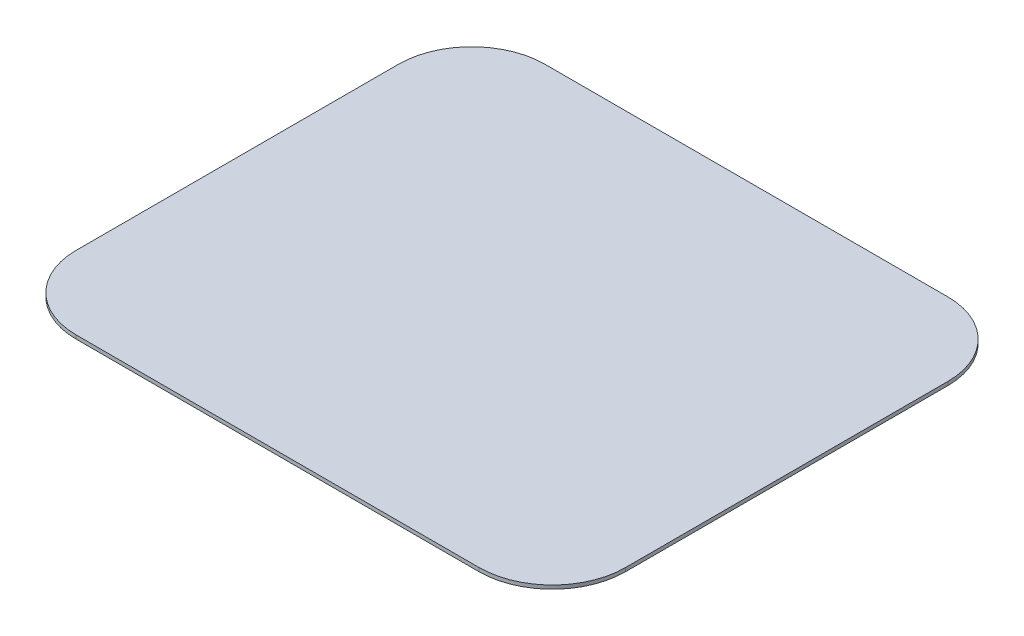
from build123d import *

# Parameters (mm, degrees)
BOSS_EXTRUDE1_DEPTH = 2


with BuildPart() as part:
    # Sketch1 → Boss-Extrude1 (new body)
    with BuildSketch(Plane(origin=(0, 0, 0), x_dir=(1, 0, 0), z_dir=(0, 1, 0))):
        with BuildLine():
            Line((-92.716981132, 79.594339623), (127.283018868, 79.594339623))
            ThreePointArc((127.283018868, 79.594339623), (155.567290115, 67.87861087), (167.283018868, 39.594339623))
            Line((167.283018868, 39.594339623), (167.283018868, -136.405660377))
            ThreePointArc((167.283018868, -136.405660377), (155.567290115, -164.689931625), (127.283018868, -176.405660377))
            Line((127.283018868, -176.405660377), (-92.716981132, -176.405660377))
            ThreePointArc((-92.716981132, -176.405660377), (-121.00125238, -164.689931625), (-132.716981132, -136.405660377))
            Line((-132.716981132, -136.405660377), (-132.716981132, 39.594339623))
            ThreePointArc((-132.716981132, 39.594339623), (-121.00125238, 67.87861087), (-92.716981132, 79.594339623))
        make_face()
    extrude(amount=BOSS_EXTRUDE1_DEPTH)


solid = part.part
